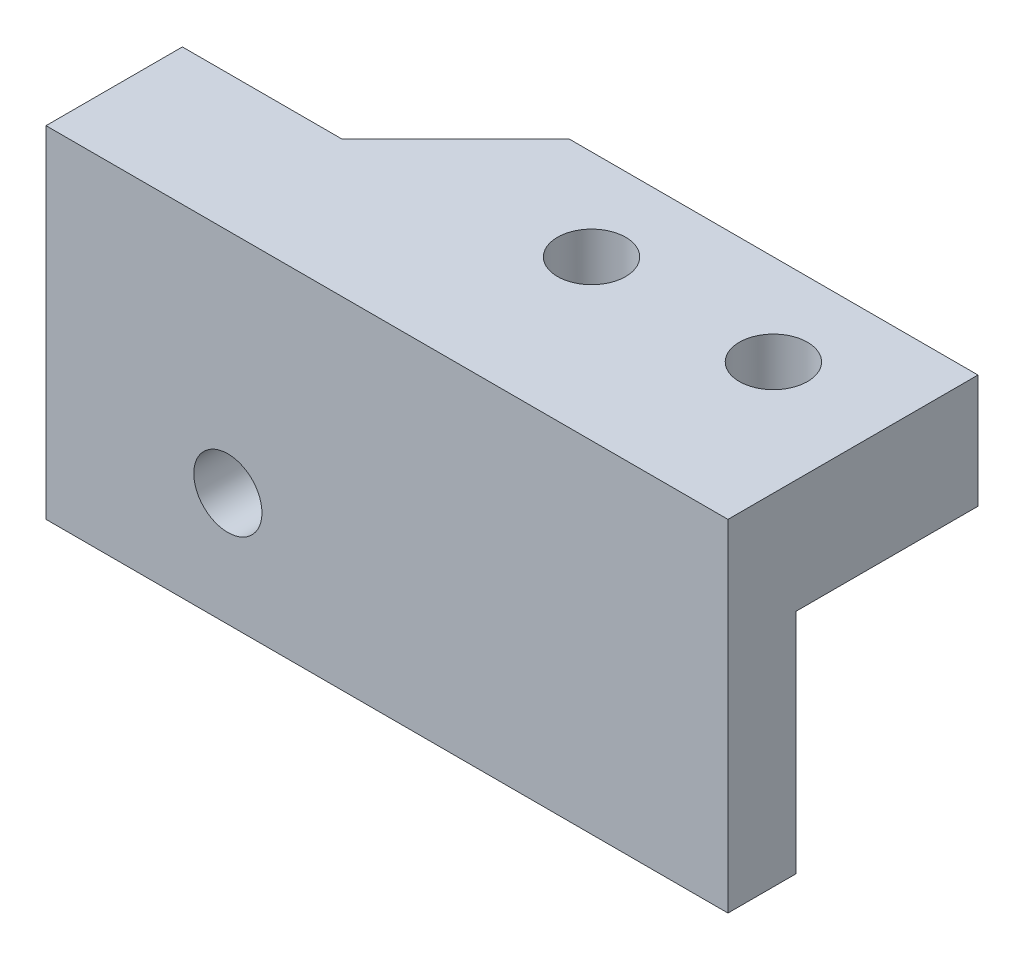
from build123d import *

# Parameters (mm, degrees)
SKETCH_1_W          = 30
SKETCH_1_H          = 15
SKETCH_1_R          = 1.5
EXTRUDE_1_DEPTH     = 11
SKETCH_2_R          = 1.5
CUT_EXTRUDE_1_DEPTH = 20
SKETCH_3_W          = 12
SKETCH_3_H          = 5
CUT_EXTRUDE_2_DEPTH = 20
SKETCH_5_W          = 18
SKETCH_5_H          = 8
CUT_EXTRUDE_3_DEPTH = 10
CHAMFER_1_SIZE      = 5


with BuildPart() as part:
    # 草图1 → 凸台-拉伸1 (new body)
    with BuildSketch(Plane.XY):
        with Locations((15, 7.5)):
            Rectangle(SKETCH_1_W, SKETCH_1_H)
        with Locations((8, 5)):
            Circle(SKETCH_1_R, mode=Mode.SUBTRACT)
    extrude(amount=EXTRUDE_1_DEPTH)

    # 草图2 → 切除-拉伸1 (cut)
    with BuildSketch(Plane.XZ):
        with Locations(Location((25, 4, 0), (0, 0, 270))):
            Circle(SKETCH_2_R)
        with Locations(Location((17, 4, 0), (0, 0, 270))):
            Circle(SKETCH_2_R)
    extrude(amount=-CUT_EXTRUDE_1_DEPTH, mode=Mode.SUBTRACT)

    # 草图3 → 切除-拉伸2 (cut)
    with BuildSketch(Plane.XZ):
        with Locations((6, 2.5)):
            Rectangle(SKETCH_3_W, SKETCH_3_H)
    extrude(amount=-CUT_EXTRUDE_2_DEPTH, mode=Mode.SUBTRACT)

    # 草图5 → 切除-拉伸3 (cut)
    with BuildSketch(Plane.XZ):
        with Locations((21, 4)):
            Rectangle(SKETCH_5_W, SKETCH_5_H)
    extrude(amount=-CUT_EXTRUDE_3_DEPTH, mode=Mode.SUBTRACT)

    # 倒角1
    chamfer_1_edges = [part.edges().sort_by_distance(p)[0] for p in [
        (12, 12.5, 5),
    ]]
    chamfer(chamfer_1_edges, length=CHAMFER_1_SIZE - 0.0001)  # a hair under: the kernel refuses the full size


solid = part.part
